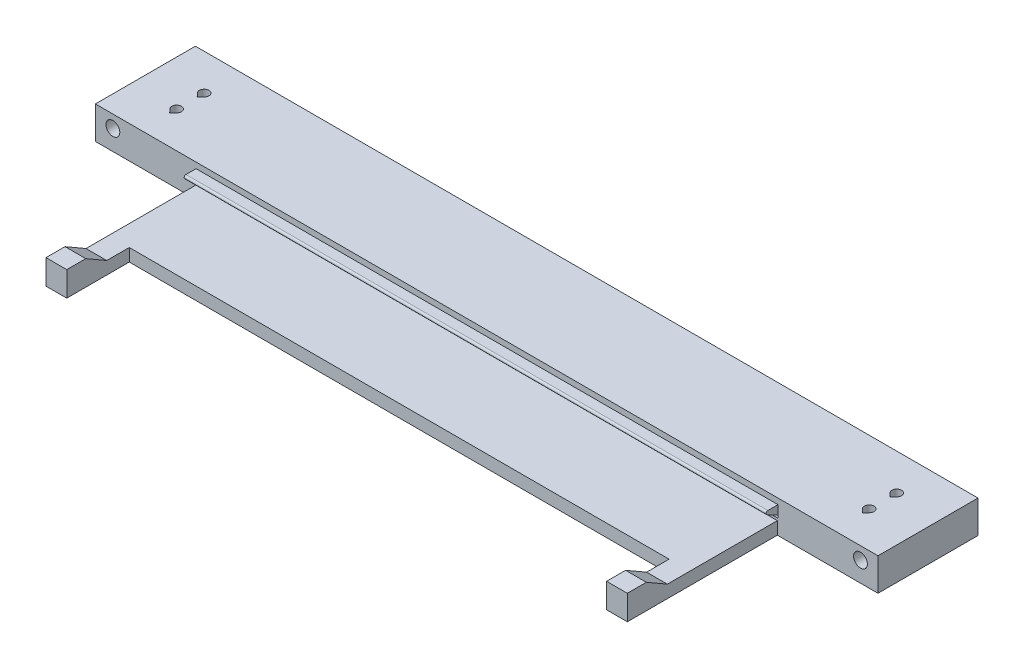
from build123d import *

# Parameters (mm, degrees)
SKETCH1_W           = 40
SKETCH1_H           = 10
BOSS_EXTRUDE1_DEPTH = 312.997959
SKETCH2_W           = 232.99
SKETCH2_H           = 1.2
CUT_EXTRUDE1_DEPTH  = 316.701951749
SKETCH3_R           = 1.9177
CUT_EXTRUDE2_DEPTH  = 316.701951749
CUT_EXTRUDE3_DEPTH  = 4.3
SKETCH5_R           = 2.762258299
CUT_EXTRUDE4_DEPTH  = 316.701951749
SKETCH6_W           = 4
SKETCH6_H           = 6.8326
CUT_EXTRUDE5_DEPTH  = 15
SKETCH7_W           = 232.5
SKETCH7_H           = 2.046306953
BOSS_EXTRUDE2_DEPTH = 60
CUT_EXTRUDE6_REACH  = 320.796
SKETCH8_W           = 215.9
SKETCH8_H           = 25
BOSS_EXTRUDE3_DEPTH = 3
SKETCH10_W          = 18
SKETCH10_H          = 4.844296322
BOSS_EXTRUDE4_DEPTH = 8.3
BOSS_EXTRUDE6_DEPTH = 232.745
FILLET1_R           = 0.7
SKETCH15_W          = 8.3
SKETCH15_H          = 18
BOSS_EXTRUDE8_DEPTH = 4.844296322
CUT_EXTRUDE8_DEPTH  = 319.961944969
CHAMFER1_SIZE       = 10.392304845
CHAMFER1_SIZE_2     = 6


with BuildPart() as part:
    # Sketch1 → Boss-Extrude1 (new body)
    with BuildSketch(Plane(origin=(0, 0, 0), x_dir=(0, 0, -1), z_dir=(1, 0, 0))):
        with Locations((20, 5)):
            Rectangle(SKETCH1_W, SKETCH1_H)
    extrude(amount=BOSS_EXTRUDE1_DEPTH)

    # Sketch2 → Cut-Extrude1 (cut, through all)
    with BuildSketch(Plane(origin=(0, 0, -40), x_dir=(-1, 0, 0), z_dir=(0, 0, -1))):
        with Locations((-156.4989795, 3.6)):
            Rectangle(SKETCH2_W, SKETCH2_H)
    extrude(amount=-CUT_EXTRUDE1_DEPTH, mode=Mode.SUBTRACT)

    # Sketch3 → Cut-Extrude2 (cut, through all)
    with BuildSketch(Plane(origin=(0, 10, 0), x_dir=(1, 0, 0), z_dir=(0, 1, 0))):
        with Locations(Location((294.997959, 25.5, 0), (0, 0, 270))):
            Circle(SKETCH3_R)
        with Locations(Location((294.997959, 14.5, 0), (0, 0, 270))):
            Circle(SKETCH3_R)
        with Locations(Location((18, 14.5, 0), (0, 0, 90))):
            Circle(SKETCH3_R)
        with Locations(Location((18, 25.5, 0), (0, 0, 90))):
            Circle(SKETCH3_R)
    extrude(amount=-CUT_EXTRUDE2_DEPTH, mode=Mode.SUBTRACT)

    # Sketch4 → Cut-Extrude3 (cut)
    with BuildSketch(Plane.XZ):
        Polygon((14.5837, -12.527598275), (14.5837, -16.472401725), (18, -18.444803449), (21.4163, -16.472401725), (21.4163, -12.527598275), (18, -10.555196551), align=None)
        Polygon((14.5837, -23.527598275), (14.5837, -27.472401725), (18, -29.444803449), (21.4163, -27.472401725), (21.4163, -23.527598275), (18, -21.555196551), align=None)
        Polygon((298.414259, -12.527598275), (294.997959, -10.555196551), (291.581659, -12.527598275), (291.581659, -16.472401725), (294.997959, -18.444803449), (298.414259, -16.472401725), align=None)
        Polygon((291.581659, -23.527598275), (291.581659, -27.472401725), (294.997959, -29.444803449), (298.414259, -27.472401725), (298.414259, -23.527598275), (294.997959, -21.555196551), align=None)
    extrude(amount=-CUT_EXTRUDE3_DEPTH, mode=Mode.SUBTRACT)

    # Sketch5 → Cut-Extrude4 (cut, through all)
    with BuildSketch(Plane.XY):
        with Locations((7, 5)):
            Circle(SKETCH5_R)
        with Locations(Location((305.997959, 5, 0), (0, 0, 180))):
            Circle(SKETCH5_R)
    extrude(amount=-CUT_EXTRUDE4_DEPTH, mode=Mode.SUBTRACT)

    # Sketch6 → Cut-Extrude5 (cut)
    with BuildSketch(Plane.ZY):
        with Locations((-31, 5)):
            Rectangle(SKETCH6_W, SKETCH6_H)
        with Locations((-9, 5)):
            Rectangle(SKETCH6_W, SKETCH6_H)
    extrude(amount=-CUT_EXTRUDE5_DEPTH, mode=Mode.SUBTRACT)

    # Sketch7 → Boss-Extrude2 (add)
    with BuildSketch(Plane.XY):
        with Locations((156.4989795, 1.023153477)):
            Rectangle(SKETCH7_W, SKETCH7_H)
    extrude(amount=BOSS_EXTRUDE2_DEPTH)

    # Sketch8 → Cut-Extrude6 (cut, up to next)
    with BuildSketch(Plane(origin=(0, 2.046306953, 0), x_dir=(1, 0, 0), z_dir=(0, 1, 0)), mode=Mode.PRIVATE) as cut_extrude6_sk1:
        with Locations((156.4989795, -47.5)):
            Rectangle(SKETCH8_W, SKETCH8_H)
    cut_extrude6_tool1 = extrude(cut_extrude6_sk1.sketch, amount=-CUT_EXTRUDE6_REACH, mode=Mode.PRIVATE) & part.part
    add(cut_extrude6_tool1.solids().sort_by_distance((156.49898, 2.046307, 47.5))[0], mode=Mode.SUBTRACT)

    # Sketch9 → Boss-Extrude3 (add)
    with BuildSketch(Plane.XZ):
        Polygon((0, -40), (0, 0), (40.2489795, 0), (40.2489795, 60), (48.5489795, 60), (48.5489795, 35), (264.4489795, 35), (264.4489795, 60), (272.7489795, 60), (272.7489795, 0), (312.997959, 0), (312.997959, -40), align=None)
        Polygon((17.997668231, -10.55519724), (14.582534712, -12.529617991), (14.584866481, -16.474420751), (18.002331769, -18.44480276), (21.417465288, -16.470382009), (21.415133519, -12.525579249), align=None, mode=Mode.SUBTRACT)
        Polygon((18.002331769, -21.55519724), (14.584866481, -23.525579249), (14.582534712, -27.470382009), (17.997668231, -29.44480276), (21.415133519, -27.474420751), (21.417465288, -23.529617991), align=None, mode=Mode.SUBTRACT)
        Polygon((295.000290769, -10.55519724), (291.582825481, -12.525579249), (291.580493712, -16.470382009), (294.995627231, -18.44480276), (298.413092519, -16.474420751), (298.415424288, -12.529617991), align=None, mode=Mode.SUBTRACT)
        Polygon((294.995627231, -21.55519724), (291.580493712, -23.529617991), (291.582825481, -27.474420751), (295.000290769, -29.44480276), (298.415424288, -27.470382009), (298.413092519, -23.525579249), align=None, mode=Mode.SUBTRACT)
    extrude(amount=BOSS_EXTRUDE3_DEPTH)

    # Sketch10 → Boss-Extrude4 (add)
    with BuildSketch(Plane.ZY.offset(-40.2489795)):
        with Locations((51, 4.468455114)):
            Rectangle(SKETCH10_W, SKETCH10_H)
    extrude(amount=-BOSS_EXTRUDE4_DEPTH)

    # Sketch12 → Boss-Extrude6 (add)
    with BuildSketch(Plane.ZY.offset(-40.2489795)):
        Polygon((0, 4.2), (7, 7.7), (0, 7.7), align=None)
    extrude(amount=-BOSS_EXTRUDE6_DEPTH)

    # Fillet1
    fillet1_edges = [part.edges().sort_by_distance(p)[0] for p in [
        (156.6214795, 7.7, 7),
    ]]
    fillet(fillet1_edges, radius=FILLET1_R)

    # Sketch15 → Boss-Extrude8 (add)
    with BuildSketch(Plane(origin=(0, 2.046306953, 0), x_dir=(1, 0, 0), z_dir=(0, 1, 0))):
        with Locations((268.5989795, -51)):
            Rectangle(SKETCH15_W, SKETCH15_H)
    extrude(amount=BOSS_EXTRUDE8_DEPTH)

    # Sketch16 → Cut-Extrude8 (cut, through all)
    with BuildSketch(Plane(origin=(0, 10, 0), x_dir=(1, 0, 0), z_dir=(0, 1, 0))):
        with BuildLine():
            Line((16.61580053, 24.172760339), (18, 22.729156574))
            Line((18, 22.729156574), (19.38419947, 24.172760339))
            ThreePointArc((19.38419947, 24.172760339), (18, 23.5823), (16.61580053, 24.172760339))
        make_face()
        with BuildLine():
            Line((16.61580053, 13.172760339), (18, 11.729156574))
            Line((18, 11.729156574), (19.38419947, 13.172760339))
            ThreePointArc((19.38419947, 13.172760339), (18, 12.5823), (16.61580053, 13.172760339))
        make_face()
        with BuildLine():
            Line((293.61375953, 13.172760339), (294.997959, 11.729156574))
            Line((294.997959, 11.729156574), (296.38215847, 13.172760339))
            ThreePointArc((296.38215847, 13.172760339), (294.997959, 12.5823), (293.61375953, 13.172760339))
        make_face()
        with BuildLine():
            Line((293.61375953, 24.172760339), (294.997959, 22.729156574))
            Line((294.997959, 22.729156574), (296.38215847, 24.172760339))
            ThreePointArc((296.38215847, 24.172760339), (294.997959, 23.5823), (293.61375953, 24.172760339))
        make_face()
    extrude(amount=-CUT_EXTRUDE8_DEPTH, mode=Mode.SUBTRACT)

    # Chamfer1
    # the kernel refuses this chamfer: 10.392304845, 6 mm, written as the material it takes off along each edge
    with BuildSketch(Plane(origin=(13.363195676, 6.890603275, 42), x_dir=(0, 0.019326765612700778, 0.9998132206222079), z_dir=(1, 0, 0))) as chamfer1_piece_1_section:
        Polygon((CHAMFER1_SIZE * 0.999813220662, CHAMFER1_SIZE * 0.0193267656135), (-CHAMFER1_SIZE_2 * 0.0193267656127, CHAMFER1_SIZE_2 * 0.999813220622), (0, 0), align=None)
    chamfer1_piece_1 = extrude(amount=62.071567647, mode=Mode.PRIVATE)
    chamfer1_piece_1 = split(chamfer1_piece_1, bisect_by=Plane(origin=(44.3989795, 2.046306953, 45.647661679), z_dir=(0, 1, 0)), keep=Keep.TOP, mode=Mode.PRIVATE)
    add(chamfer1_piece_1, mode=Mode.SUBTRACT)
    with BuildSketch(Plane(origin=(237.563195676, 6.890603275, 42), x_dir=(0, 0.019326765612700615, 0.9998132206222079), z_dir=(1, 0, 0))) as chamfer1_piece_2_section:
        Polygon((CHAMFER1_SIZE * 0.999813220662, CHAMFER1_SIZE * 0.0193267656135), (-CHAMFER1_SIZE_2 * 0.0193267656127, CHAMFER1_SIZE_2 * 0.999813220622), (0, 0), align=None)
    chamfer1_piece_2 = extrude(amount=62.071567647, mode=Mode.PRIVATE)
    chamfer1_piece_2 = split(chamfer1_piece_2, bisect_by=Plane(origin=(268.5989795, 2.046306953, 45.647661679), z_dir=(0, 1, 0)), keep=Keep.TOP, mode=Mode.PRIVATE)
    add(chamfer1_piece_2, mode=Mode.SUBTRACT)


solid = part.part
